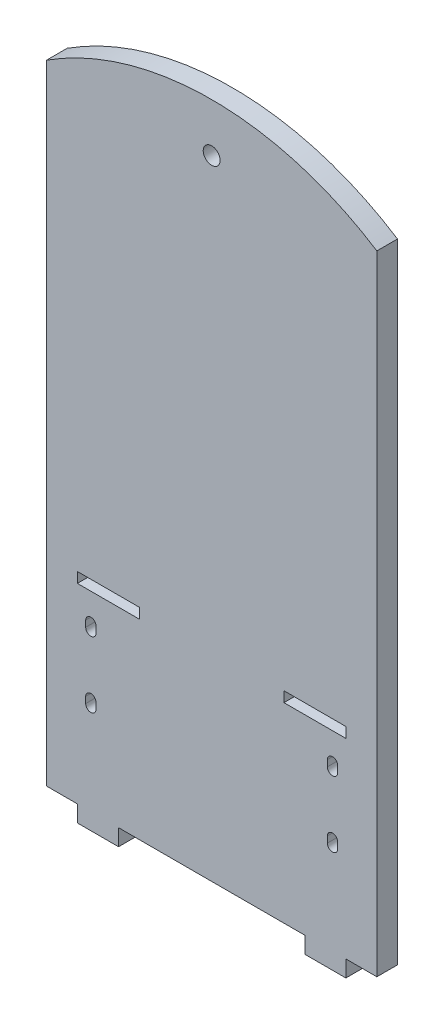
from build123d import *

# Parameters (mm, degrees)
SKETCH_1_R          = 4.1
EXTRUDE_1_DEPTH     = 10
SKETCH_2_W          = 30.05
SKETCH_2_H          = 5
CUT_EXTRUDE_1_DEPTH = 338.763230681


with BuildPart() as part:
    # 草圖1 → 填料-伸長1 (new body)
    with BuildSketch(Plane.XY):
        with BuildLine():
            Line((-80, 0), (-65, 0))
            Line((-65, 0), (-65, -8))
            Line((-65, -8), (-45.1, -8))
            Line((-45.1, -8), (-45.1, 0))
            Line((-45.1, 0), (45.1, 0))
            Line((45.1, 0), (45.1, -8))
            Line((45.1, -8), (65, -8))
            Line((65, -8), (65, 0))
            Line((65, 0), (80, 0))
            Line((80, 0), (80, 304.5))
            ThreePointArc((80, 304.5), (0, 328), (-80, 304.5))
            Line((-80, 304.5), (-80, 0))
        make_face()
        with Locations((0, 304.5)):
            Circle(SKETCH_1_R, mode=Mode.SUBTRACT)
        with BuildLine():
            Line((-61.025, 76.1), (-61.025, 79.1))
            ThreePointArc((-61.025, 79.1), (-58.525, 81.6), (-56.025, 79.1))
            Line((-56.025, 79.1), (-56.025, 76.1))
            ThreePointArc((-56.025, 76.1), (-58.525, 73.6), (-61.025, 76.1))
        make_face(mode=Mode.SUBTRACT)
        with BuildLine():
            Line((-61.025, 44.1), (-61.025, 47.1))
            ThreePointArc((-61.025, 47.1), (-58.525, 49.6), (-56.025, 47.1))
            Line((-56.025, 47.1), (-56.025, 44.1))
            ThreePointArc((-56.025, 44.1), (-58.525, 41.6), (-61.025, 44.1))
        make_face(mode=Mode.SUBTRACT)
        with BuildLine():
            Line((61.025, 44.1), (61.025, 47.1))
            ThreePointArc((61.025, 47.1), (58.525, 49.6), (56.025, 47.1))
            Line((56.025, 47.1), (56.025, 44.1))
            ThreePointArc((56.025, 44.1), (58.525, 41.6), (61.025, 44.1))
        make_face(mode=Mode.SUBTRACT)
        with BuildLine():
            Line((61.025, 76.1), (61.025, 79.1))
            ThreePointArc((61.025, 79.1), (58.525, 81.6), (56.025, 79.1))
            Line((56.025, 79.1), (56.025, 76.1))
            ThreePointArc((56.025, 76.1), (58.525, 73.6), (61.025, 76.1))
        make_face(mode=Mode.SUBTRACT)
    extrude(amount=-EXTRUDE_1_DEPTH)

    # 草圖2 → 除料-伸長1 (cut, through all)
    with BuildSketch(Plane.XY):
        with Locations((50.025, 95)):
            Rectangle(SKETCH_2_W, SKETCH_2_H)
        with Locations((-50.025, 95)):
            Rectangle(SKETCH_2_W, SKETCH_2_H)
    extrude(amount=-CUT_EXTRUDE_1_DEPTH, mode=Mode.SUBTRACT)


solid = part.part
